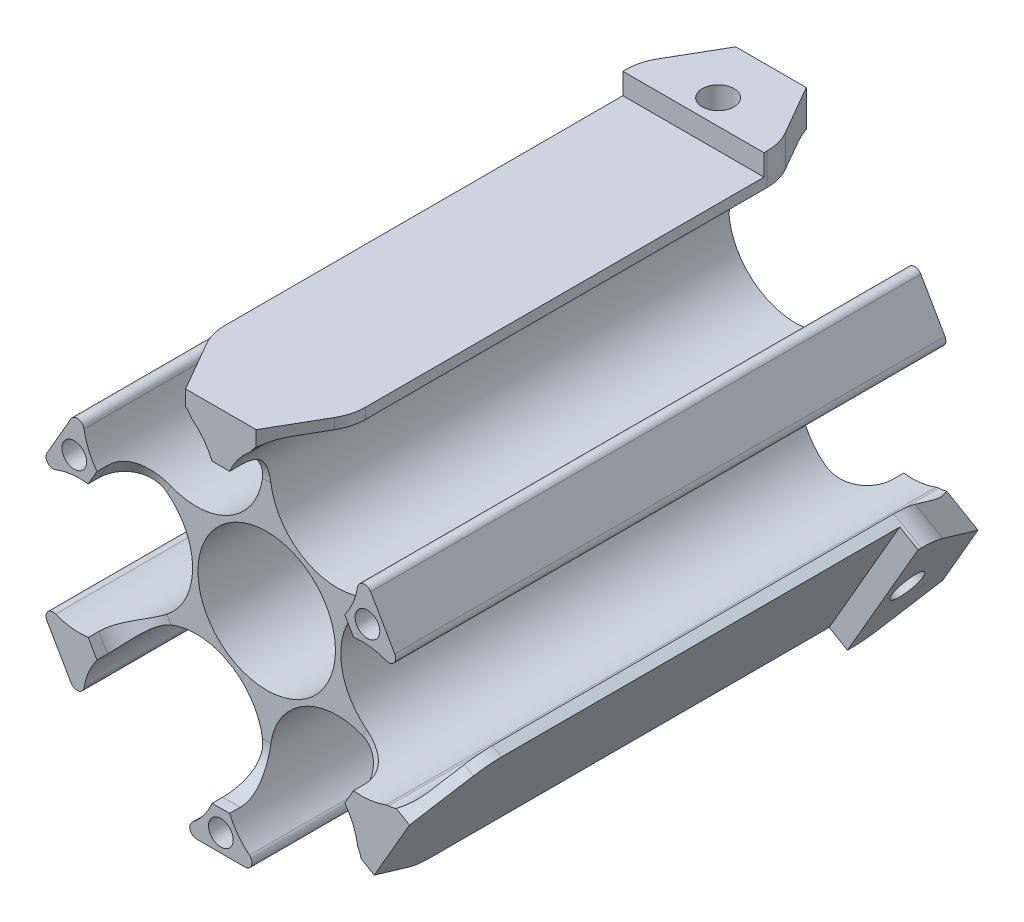
from build123d import *
from OCP.BRepFilletAPI import BRepFilletAPI_MakeChamfer

# Parameters (mm, degrees)
SKETCH_1_R               = 9.75
EXTRUDE_1_DEPTH          = 78
FILLET_1_R               = 1
SKETCH_2_R               = 1.75
CUT_EXTRUDE_1_DEPTH      = 178.5
CUT_EXTRUDE_2_DEPTH      = 6.5
FILLET_2_R               = 5
CUT_EXTRUDE_3_DEPTH      = 6.5
FILLET_3_R               = 5
SKETCH_9_W               = 20
SKETCH_9_H               = 78
EXTRUDE_4_DEPTH          = 1.5
PATTERN_CIRCULAR_6_COUNT = 3
FILLET_4_DEPTH           = 78
SKETCH_11_W              = 11
SKETCH_11_H              = 20
EXTRUDE_5_DEPTH          = 3
PATTERN_CIRCULAR_7_COUNT = 3
CHAMFER_3_SIZE           = 5
CHAMFER_3_SIZE2          = 8.660254038
CHAMFER_4_SIZE           = 5
CHAMFER_4_SIZE2          = 8.660254038
SKETCH_13_R              = 2.25
CUT_EXTRUDE_6_DEPTH      = 6
PATTERN_CIRCULAR_8_COUNT = 3
FILLET_5_R               = 7


with BuildPart() as part:
    # Эскиз1 → Бобышка-Вытянуть1 (new body)
    with BuildSketch(Plane.XY):
        with BuildLine():
            ThreePointArc((-0.5, 17.320508076), (-11.246135967, 7.902591897), (-19.17308319, 19.791245777))
            Line((-19.17308319, 19.791245777), (-26.726263211, 6.708754223))
            ThreePointArc((-26.726263211, 6.708754223), (-16.370227314, 8.779222645), (-10.5, 0))
            ThreePointArc((-10.5, 0), (-16.370227314, -8.779222645), (-26.726263211, -6.708754223))
            Line((-26.726263211, -6.708754223), (-19.17308319, -19.791245777))
            ThreePointArc((-19.17308319, -19.791245777), (-11.246135967, -7.902591897), (-0.5, -17.320508076))
            ThreePointArc((-0.5, -17.320508076), (-2.466913322, -23.108651569), (-7.553180021, -26.5))
            Line((-7.553180021, -26.5), (7.553180021, -26.5))
            ThreePointArc((7.553180021, -26.5), (4.211856507, -9.787421397), (19.5, -17.320508076))
            ThreePointArc((19.5, -17.320508076), (19.417916179, -18.566644042), (19.17308319, -19.791245777))
            Line((19.17308319, -19.791245777), (26.726263211, -6.708754223))
            ThreePointArc((26.726263211, -6.708754223), (10.5, 0), (26.726263211, 6.708754223))
            Line((26.726263211, 6.708754223), (19.17308319, 19.791245777))
            ThreePointArc((19.17308319, 19.791245777), (19.417916179, 18.566644042), (19.5, 17.320508076))
            ThreePointArc((19.5, 17.320508076), (4.211856507, 9.787421397), (7.553180021, 26.5))
            Line((7.553180021, 26.5), (-7.553180021, 26.5))
            ThreePointArc((-7.553180021, 26.5), (-2.466913322, 23.108651569), (-0.5, 17.320508076))
        make_face()
        Circle(SKETCH_1_R, mode=Mode.SUBTRACT)
    extrude(amount=EXTRUDE_1_DEPTH)

    # Скругление1
    fillet_1_edges = [part.edges().sort_by_distance(p)[0] for p in [
        (-26.726263211, 6.708754223, 39),
        (-19.17308319, 19.791245777, 39),
        (-7.553180021, 26.5, 39),
        (7.553180021, 26.5, 39),
        (19.17308319, 19.791245777, 39),
        (26.726263211, 6.708754223, 39),
        (26.726263211, -6.708754223, 39),
        (19.17308319, -19.791245777, 39),
        (7.553180021, -26.5, 39),
        (-7.553180021, -26.5, 39),
        (-19.17308319, -19.791245777, 39),
        (-26.726263211, -6.708754223, 39),
    ]]
    fillet(fillet_1_edges, radius=FILLET_1_R)

    # Эскиз2 → Вырез-Вытянуть1 (cut)
    with BuildSketch(Plane(origin=(0, 0, 0), x_dir=(-1, 0, 0), z_dir=(0, 0, -1))):
        with Locations((0, -24)):
            Circle(SKETCH_2_R)
        with Locations((-20.784609691, 12)):
            Circle(SKETCH_2_R)
        with Locations((20.784609691, 12)):
            Circle(SKETCH_2_R)
    extrude(amount=-CUT_EXTRUDE_1_DEPTH, mode=Mode.SUBTRACT)

    # Эскиз4 → Вырез-Вытянуть2 (cut)
    with BuildSketch(Plane(origin=(0, 0, 0), x_dir=(-1, 0, 0), z_dir=(0, 0, -1))):
        Polygon((-24.248711306, 0), (-12.124355653, -21), (12.124355653, -21), (24.248711306, 0), (12.124355653, 21), (-12.124355653, 21), align=None)
    extrude(amount=-CUT_EXTRUDE_2_DEPTH, mode=Mode.SUBTRACT)

    # Скругление2
    # the kernel refuses this fillet: 5 mm, written as the material it adds along each edge
    with BuildSketch(Plane(origin=(-11.315783963, -22.400487249, 6.5), x_dir=(0.8660254037844387, 0.49999999999999967, 0), z_dir=(-0.4999999999999997, 0.8660254037844388, 0))) as fillet_2_piece_1_section:
        with BuildLine():
            CenterArc((FILLET_2_R, FILLET_2_R), FILLET_2_R, 180, 90)
            Line((0, FILLET_2_R), (0, 0))
            Line((0, 0), (FILLET_2_R, 0))
        make_face()
    fillet_2_piece_1 = extrude(amount=27.482998067, mode=Mode.PRIVATE)
    fillet_2_piece_1 = fillet_2_piece_1 - Plane(origin=(-10, -17.320508076, 6.5), x_dir=(-0.9655877042082922, -0.26007765279192985, 0), z_dir=(0, 0, -1)) * Cylinder(9.5, 75, mode=Mode.PRIVATE)
    fillet_2_piece_1 = fillet_2_piece_1 - Plane(origin=(-20, 0, 6.5), x_dir=(-0.7080277063785602, 0.7061846550303366, 0), z_dir=(0, 0, -1)) * Cylinder(9.5, 75, mode=Mode.PRIVATE)
    add(fillet_2_piece_1)
    with BuildSketch(Plane(origin=(13.741499034, -21, 6.5), x_dir=(0, 0, -1), z_dir=(-1, 0, 0))) as fillet_2_piece_2_section:
        with BuildLine():
            CenterArc((FILLET_2_R, -FILLET_2_R), FILLET_2_R, 90, 90)
            Line((0, -FILLET_2_R), (0, 0))
            Line((0, 0), (FILLET_2_R, 0))
        make_face()
    fillet_2_piece_2 = extrude(amount=27.482998067, mode=Mode.PRIVATE)
    fillet_2_piece_2 = fillet_2_piece_2 - Plane(origin=(-10, -17.320508076, 6.5), x_dir=(-0.9655877042082922, -0.26007765279192985, 0), z_dir=(0, 0, -1)) * Cylinder(9.5, 75, mode=Mode.PRIVATE)
    fillet_2_piece_2 = fillet_2_piece_2 - Plane(origin=(10, -17.320508076, 6.5), x_dir=(-0.25755999782971145, -0.9662623078222389, 0), z_dir=(0, 0, -1)) * Cylinder(9.5, 75, mode=Mode.PRIVATE)
    add(fillet_2_piece_2)
    with BuildSketch(Plane(origin=(25.057282996, 1.400487249, 6.5), x_dir=(-0.8660254037844386, 0.4999999999999999, 0), z_dir=(-0.5, -0.8660254037844387, 0))) as fillet_2_piece_3_section:
        with BuildLine():
            CenterArc((FILLET_2_R, FILLET_2_R), FILLET_2_R, 180, 90)
            Line((0, FILLET_2_R), (0, 0))
            Line((0, 0), (FILLET_2_R, 0))
        make_face()
    fillet_2_piece_3 = extrude(amount=27.482998067, mode=Mode.PRIVATE)
    fillet_2_piece_3 = fillet_2_piece_3 - Plane(origin=(10, -17.320508076, 6.5), x_dir=(-0.25755999782971145, -0.9662623078222389, 0), z_dir=(0, 0, -1)) * Cylinder(9.5, 75, mode=Mode.PRIVATE)
    fillet_2_piece_3 = fillet_2_piece_3 - Plane(origin=(20, 0, 6.5), x_dir=(0.7080277063785567, -0.7061846550303401, 0), z_dir=(0, 0, -1)) * Cylinder(9.5, 75, mode=Mode.PRIVATE)
    add(fillet_2_piece_3)
    with BuildSketch(Plane(origin=(11.315783963, 22.400487249, 6.5), x_dir=(-0.8660254037844389, -0.49999999999999967, 0), z_dir=(0.49999999999999967, -0.8660254037844389, 0))) as fillet_2_piece_4_section:
        with BuildLine():
            CenterArc((FILLET_2_R, FILLET_2_R), FILLET_2_R, 180, 90)
            Line((0, FILLET_2_R), (0, 0))
            Line((0, 0), (FILLET_2_R, 0))
        make_face()
    fillet_2_piece_4 = extrude(amount=27.482998067, mode=Mode.PRIVATE)
    fillet_2_piece_4 = fillet_2_piece_4 - Plane(origin=(20, 0, 6.5), x_dir=(0.7080277063785567, -0.7061846550303401, 0), z_dir=(0, 0, -1)) * Cylinder(9.5, 75, mode=Mode.PRIVATE)
    fillet_2_piece_4 = fillet_2_piece_4 - Plane(origin=(10, 17.320508076, 6.5), x_dir=(0.9655877042082929, 0.2600776527919273, 0), z_dir=(0, 0, -1)) * Cylinder(9.5, 75, mode=Mode.PRIVATE)
    add(fillet_2_piece_4)
    with BuildSketch(Plane(origin=(-13.741499034, 21, 6.5), x_dir=(0, -1, 0), z_dir=(1, 0, 0))) as fillet_2_piece_5_section:
        with BuildLine():
            CenterArc((FILLET_2_R, FILLET_2_R), FILLET_2_R, 180, 90)
            Line((0, FILLET_2_R), (0, 0))
            Line((0, 0), (FILLET_2_R, 0))
        make_face()
    fillet_2_piece_5 = extrude(amount=27.482998067, mode=Mode.PRIVATE)
    fillet_2_piece_5 = fillet_2_piece_5 - Plane(origin=(10, 17.320508076, 6.5), x_dir=(0.9655877042082929, 0.2600776527919273, 0), z_dir=(0, 0, -1)) * Cylinder(9.5, 75, mode=Mode.PRIVATE)
    fillet_2_piece_5 = fillet_2_piece_5 - Plane(origin=(-10, 17.320508076, 6.5), x_dir=(0.25755999782976996, 0.9662623078222233, 0), z_dir=(0, 0, -1)) * Cylinder(9.5, 75, mode=Mode.PRIVATE)
    add(fillet_2_piece_5)
    with BuildSketch(Plane(origin=(-25.057282996, -1.400487249, 6.5), x_dir=(0.8660254037844384, -0.5000000000000003, 0), z_dir=(0.5000000000000004, 0.8660254037844385, 0))) as fillet_2_piece_6_section:
        with BuildLine():
            CenterArc((FILLET_2_R, FILLET_2_R), FILLET_2_R, 180, 90)
            Line((0, FILLET_2_R), (0, 0))
            Line((0, 0), (FILLET_2_R, 0))
        make_face()
    fillet_2_piece_6 = extrude(amount=27.482998067, mode=Mode.PRIVATE)
    fillet_2_piece_6 = fillet_2_piece_6 - Plane(origin=(-20, 0, 6.5), x_dir=(-0.7080277063785602, 0.7061846550303366, 0), z_dir=(0, 0, -1)) * Cylinder(9.5, 75, mode=Mode.PRIVATE)
    fillet_2_piece_6 = fillet_2_piece_6 - Plane(origin=(-10, 17.320508076, 6.5), x_dir=(0.25755999782976996, 0.9662623078222233, 0), z_dir=(0, 0, -1)) * Cylinder(9.5, 75, mode=Mode.PRIVATE)
    add(fillet_2_piece_6)

    # Эскиз5 → Вырез-Вытянуть3 (cut)
    with BuildSketch(Plane.XY.offset(78)):
        Polygon((12.124355653, -21), (24.248711306, 0), (12.124355653, 21), (-12.124355653, 21), (-24.248711306, 0), (-12.124355653, -21), align=None)
    extrude(amount=-CUT_EXTRUDE_3_DEPTH, mode=Mode.SUBTRACT)

    # Скругление3
    # the kernel refuses this fillet: 5 mm, written as the material it adds along each edge
    with BuildSketch(Plane(origin=(25.057282996, -1.400487249, 71.5), x_dir=(-0.8660254037844389, -0.49999999999999967, 0), z_dir=(-0.49999999999999967, 0.8660254037844389, 0))) as fillet_3_piece_1_section:
        with BuildLine():
            CenterArc((FILLET_3_R, FILLET_3_R), FILLET_3_R, 180, 90)
            Line((0, FILLET_3_R), (0, 0))
            Line((0, 0), (FILLET_3_R, 0))
        make_face()
    fillet_3_piece_1 = extrude(amount=27.482998067, mode=Mode.PRIVATE)
    fillet_3_piece_1 = fillet_3_piece_1 - Plane(origin=(10, 17.320508076, 71.5), x_dir=(0.9655877042082548, 0.2600776527920686, 0), z_dir=(0, 0, -1)) * Cylinder(9.5, 75, mode=Mode.PRIVATE)
    fillet_3_piece_1 = fillet_3_piece_1 - Plane(origin=(20, 0, 71.5), x_dir=(0.7080277063789479, -0.706184655029948, 0), z_dir=(0, 0, -1)) * Cylinder(9.5, 75, mode=Mode.PRIVATE)
    add(fillet_3_piece_1)
    with BuildSketch(Plane(origin=(11.315783963, -22.400487249, 71.5), x_dir=(-0.8660254037844387, 0.5, 0), z_dir=(0.5, 0.8660254037844387, 0))) as fillet_3_piece_2_section:
        with BuildLine():
            CenterArc((FILLET_3_R, FILLET_3_R), FILLET_3_R, 180, 90)
            Line((0, FILLET_3_R), (0, 0))
            Line((0, 0), (FILLET_3_R, 0))
        make_face()
    fillet_3_piece_2 = extrude(amount=27.482998067, mode=Mode.PRIVATE)
    fillet_3_piece_2 = fillet_3_piece_2 - Plane(origin=(10, -17.320508076, 71.5), x_dir=(-0.2575599978300403, -0.9662623078221512, 0), z_dir=(0, 0, -1)) * Cylinder(9.5, 75, mode=Mode.PRIVATE)
    fillet_3_piece_2 = fillet_3_piece_2 - Plane(origin=(20, 0, 71.5), x_dir=(0.7080277063789479, -0.706184655029948, 0), z_dir=(0, 0, -1)) * Cylinder(9.5, 75, mode=Mode.PRIVATE)
    add(fillet_3_piece_2)
    with BuildSketch(Plane(origin=(-13.741499034, -21, 71.5), x_dir=(0, 1, 0), z_dir=(1, 0, 0))) as fillet_3_piece_3_section:
        with BuildLine():
            CenterArc((FILLET_3_R, FILLET_3_R), FILLET_3_R, 180, 90)
            Line((0, FILLET_3_R), (0, 0))
            Line((0, 0), (FILLET_3_R, 0))
        make_face()
    fillet_3_piece_3 = extrude(amount=27.482998067, mode=Mode.PRIVATE)
    fillet_3_piece_3 = fillet_3_piece_3 - Plane(origin=(10, -17.320508076, 71.5), x_dir=(-0.2575599978300403, -0.9662623078221512, 0), z_dir=(0, 0, -1)) * Cylinder(9.5, 75, mode=Mode.PRIVATE)
    fillet_3_piece_3 = fillet_3_piece_3 - Plane(origin=(-10, -17.320508076, 71.5), x_dir=(-0.9655877042082548, -0.2600776527920686, 0), z_dir=(0, 0, -1)) * Cylinder(9.5, 75, mode=Mode.PRIVATE)
    add(fillet_3_piece_3)
    with BuildSketch(Plane(origin=(-25.057282996, 1.400487249, 71.5), x_dir=(0, 0, 1), z_dir=(0.4999999999999997, -0.8660254037844388, 0))) as fillet_3_piece_4_section:
        with BuildLine():
            CenterArc((FILLET_3_R, -FILLET_3_R), FILLET_3_R, 90, 90)
            Line((0, -FILLET_3_R), (0, 0))
            Line((0, 0), (FILLET_3_R, 0))
        make_face()
    fillet_3_piece_4 = extrude(amount=27.482998067, mode=Mode.PRIVATE)
    fillet_3_piece_4 = fillet_3_piece_4 - Plane(origin=(-20, 0, 71.5), x_dir=(-0.7080277063789479, 0.706184655029948, 0), z_dir=(0, 0, -1)) * Cylinder(9.5, 75, mode=Mode.PRIVATE)
    fillet_3_piece_4 = fillet_3_piece_4 - Plane(origin=(-10, -17.320508076, 71.5), x_dir=(-0.9655877042082548, -0.2600776527920686, 0), z_dir=(0, 0, -1)) * Cylinder(9.5, 75, mode=Mode.PRIVATE)
    add(fillet_3_piece_4)
    with BuildSketch(Plane(origin=(-11.315783963, 22.400487249, 71.5), x_dir=(0.8660254037844385, -0.5000000000000004, 0), z_dir=(-0.5000000000000004, -0.8660254037844385, 0))) as fillet_3_piece_5_section:
        with BuildLine():
            CenterArc((FILLET_3_R, FILLET_3_R), FILLET_3_R, 180, 90)
            Line((0, FILLET_3_R), (0, 0))
            Line((0, 0), (FILLET_3_R, 0))
        make_face()
    fillet_3_piece_5 = extrude(amount=27.482998067, mode=Mode.PRIVATE)
    fillet_3_piece_5 = fillet_3_piece_5 - Plane(origin=(-20, 0, 71.5), x_dir=(-0.7080277063789479, 0.706184655029948, 0), z_dir=(0, 0, -1)) * Cylinder(9.5, 75, mode=Mode.PRIVATE)
    fillet_3_piece_5 = fillet_3_piece_5 - Plane(origin=(-10, 17.320508076, 71.5), x_dir=(0.2575599978300403, 0.9662623078221512, 0), z_dir=(0, 0, -1)) * Cylinder(9.5, 75, mode=Mode.PRIVATE)
    add(fillet_3_piece_5)
    with BuildSketch(Plane(origin=(13.741499034, 21, 71.5), x_dir=(0, -1, 0), z_dir=(-1, 0, 0))) as fillet_3_piece_6_section:
        with BuildLine():
            CenterArc((FILLET_3_R, FILLET_3_R), FILLET_3_R, 180, 90)
            Line((0, FILLET_3_R), (0, 0))
            Line((0, 0), (FILLET_3_R, 0))
        make_face()
    fillet_3_piece_6 = extrude(amount=27.482998067, mode=Mode.PRIVATE)
    fillet_3_piece_6 = fillet_3_piece_6 - Plane(origin=(-10, 17.320508076, 71.5), x_dir=(0.2575599978300403, 0.9662623078221512, 0), z_dir=(0, 0, -1)) * Cylinder(9.5, 75, mode=Mode.PRIVATE)
    fillet_3_piece_6 = fillet_3_piece_6 - Plane(origin=(10, 17.320508076, 71.5), x_dir=(0.9655877042082548, 0.2600776527920686, 0), z_dir=(0, 0, -1)) * Cylinder(9.5, 75, mode=Mode.PRIVATE)
    add(fillet_3_piece_6)

    # Эскиз9 → Бобышка-Вытянуть4 (add)
    with BuildSketch(Plane(origin=(0, 26.5, 0), x_dir=(1, 0, 0), z_dir=(0, 1, 0))):
        with Locations((0, -39)):
            Rectangle(SKETCH_9_W, SKETCH_9_H)
    extrude_4 = extrude(amount=EXTRUDE_4_DEPTH)

    # Круговой массив6: Бобышка-Вытянуть4 ×3 about axis, 1 skipped
    pattern_circular_6_axis = Axis((0, 0, 78), (0, 0, 1))
    add([extrude_4.rotate(pattern_circular_6_axis, i * 360 / PATTERN_CIRCULAR_6_COUNT) for i in range(1, PATTERN_CIRCULAR_6_COUNT) if i not in (1,)])

    # Скругление4: read off the stored shape, not the designer's step
    # Скругление4 outline → Скругление4 (add)
    with BuildSketch(Plane.XY):
        with BuildLine():
            ThreePointArc((21.241553812, -16.208549565), (20.375528409, -16.708549564), (19.509503005, -16.208549565))
            ThreePointArc((19.509503005, -16.208549565), (19.911426794, -17.708549565), (19.509503005, -19.208549565))
            Line((19.509503005, -19.208549565), (21.241553812, -16.208549565))
        make_face()
        with BuildLine():
            Line((24.657792588, -10.291450435), (26.389843396, -7.291450435))
            ThreePointArc((26.389843396, -7.291450435), (25.291767184, -8.389526646), (23.791767184, -8.791450435))
            ThreePointArc((23.791767184, -8.791450435), (24.657792588, -9.291450435), (24.657792588, -10.291450435))
        make_face()
        with BuildLine():
            Line((-3.416238776, 26.5), (-6.880340391, 26.5))
            ThreePointArc((-6.880340391, 26.5), (-5.380340391, 26.098076211), (-4.282264179, 25))
            ThreePointArc((-4.282264179, 25), (-4.282264179, 26), (-3.416238776, 26.5))
        make_face()
        with BuildLine():
            ThreePointArc((3.416238776, 26.5), (4.282264179, 26), (4.282264179, 25))
            ThreePointArc((4.282264179, 25), (5.380340391, 26.098076211), (6.880340391, 26.5))
            Line((6.880340391, 26.5), (3.416238776, 26.5))
        make_face()
    extrude(amount=FILLET_4_DEPTH)

    # Эскиз11 → Бобышка-Вытянуть5 (add)
    with BuildSketch(Plane(origin=(24.248711306, -14, 0), x_dir=(0, 0, -1), z_dir=(0.8660254037844433, -0.4999999999999923, 0))):
        with Locations((-5.5, 0)):
            Rectangle(SKETCH_11_W, SKETCH_11_H)
    extrude_5 = extrude(amount=EXTRUDE_5_DEPTH)

    # Круговой массив7: Бобышка-Вытянуть5 ×3 about axis, 1 skipped
    pattern_circular_7_axis = Axis((0, 0, 78), (0, 0, 1))
    add([extrude_5.rotate(pattern_circular_7_axis, i * 360 / PATTERN_CIRCULAR_7_COUNT) for i in range(1, PATTERN_CIRCULAR_7_COUNT) if i not in (2,)])

    # Фаска3: one chamfer whose edges measure the first distance from different faces: ONE call of the kernel's chamfer builder (chamfer() names one face for all edges)
    chamfer_3_edges_1 = [part.edges().sort_by_distance(p)[0] for p in [
        (-10, 28.75, 0),
    ]]
    chamfer_3_side_1 = [part.faces().sort_by_distance(p)[0] for p in [
        (0, 27.53297258, 0),
    ]]
    chamfer_3_edges_2 = [part.edges().sort_by_distance(p)[0] for p in [
        (10, 27.25, 78),
    ]]
    chamfer_3_side_2 = [part.faces().sort_by_distance(p)[0] for p in [
        (0, 25.725684777, 78),
    ]]
    chamfer_3_edges_3 = [part.edges().sort_by_distance(p)[0] for p in [
        (29.898230359, -5.714745962, 0),
    ]]
    chamfer_3_side_3 = [part.faces().sort_by_distance(p)[0] for p in [
        (23.844253696, -13.76648629, 0),
    ]]
    chamfer_3_edges_4 = [part.edges().sort_by_distance(p)[0] for p in [
        (18.599192253, -22.285254038, 78),
    ]]
    chamfer_3_side_4 = [part.faces().sort_by_distance(p)[0] for p in [
        (22.279096546, -12.862842388, 78),
    ]]
    chamfer_3 = BRepFilletAPI_MakeChamfer(part.part.solid().wrapped)
    for e in chamfer_3_edges_1:
        chamfer_3.Add(CHAMFER_3_SIZE, CHAMFER_3_SIZE2, e.wrapped, chamfer_3_side_1[0].wrapped)  # the first distance lies on this face
    for e in chamfer_3_edges_2:
        chamfer_3.Add(CHAMFER_3_SIZE, CHAMFER_3_SIZE2, e.wrapped, chamfer_3_side_2[0].wrapped)  # the first distance lies on this face
    for e in chamfer_3_edges_3:
        chamfer_3.Add(CHAMFER_3_SIZE, CHAMFER_3_SIZE2, e.wrapped, chamfer_3_side_3[0].wrapped)  # the first distance lies on this face
    for e in chamfer_3_edges_4:
        chamfer_3.Add(CHAMFER_3_SIZE, CHAMFER_3_SIZE2, e.wrapped, chamfer_3_side_4[0].wrapped)  # the first distance lies on this face
    add(Compound.cast(chamfer_3.Shape()), mode=Mode.REPLACE)

    # Фаска4: one chamfer whose edges measure the first distance from different faces: ONE call of the kernel's chamfer builder (chamfer() names one face for all edges)
    chamfer_4_edges_1 = [part.edges().sort_by_distance(p)[0] for p in [
        (10, 28.75, 0),
    ]]
    chamfer_4_side_1 = [part.faces().sort_by_distance(p)[0] for p in [
        (1.668868734, 27.270313738, 0),
    ]]
    chamfer_4_edges_2 = [part.edges().sort_by_distance(p)[0] for p in [
        (-10, 27.25, 78),
    ]]
    chamfer_4_side_2 = [part.faces().sort_by_distance(p)[0] for p in [
        (-1.017378688, 25.522553225, 78),
    ]]
    chamfer_4_edges_3 = [part.edges().sort_by_distance(p)[0] for p in [
        (19.898230359, -23.035254038, 0),
    ]]
    chamfer_4_side_3 = [part.faces().sort_by_distance(p)[0] for p in [
        (22.782350099, -15.080439588, 0),
    ]]
    chamfer_4_edges_4 = [part.edges().sort_by_distance(p)[0] for p in [
        (28.599192253, -4.964745962, 78),
    ]]
    chamfer_4_side_4 = [part.faces().sort_by_distance(p)[0] for p in [
        (22.611868807, -11.880200824, 78),
    ]]
    chamfer_4 = BRepFilletAPI_MakeChamfer(part.part.solid().wrapped)
    for e in chamfer_4_edges_1:
        chamfer_4.Add(CHAMFER_4_SIZE, CHAMFER_4_SIZE2, e.wrapped, chamfer_4_side_1[0].wrapped)  # the first distance lies on this face
    for e in chamfer_4_edges_2:
        chamfer_4.Add(CHAMFER_4_SIZE, CHAMFER_4_SIZE2, e.wrapped, chamfer_4_side_2[0].wrapped)  # the first distance lies on this face
    for e in chamfer_4_edges_3:
        chamfer_4.Add(CHAMFER_4_SIZE, CHAMFER_4_SIZE2, e.wrapped, chamfer_4_side_3[0].wrapped)  # the first distance lies on this face
    for e in chamfer_4_edges_4:
        chamfer_4.Add(CHAMFER_4_SIZE, CHAMFER_4_SIZE2, e.wrapped, chamfer_4_side_4[0].wrapped)  # the first distance lies on this face
    add(Compound.cast(chamfer_4.Shape()), mode=Mode.REPLACE)

    # Эскиз13 → Вырез-Вытянуть6 (cut)
    with BuildSketch(Plane(origin=(26.846787517, -15.5, 0), x_dir=(0, 0, -1), z_dir=(0.8660254037844431, -0.4999999999999924, 0))):
        with Locations(Location((-7.5, 0, 0), (0, 0, 90))):
            Circle(SKETCH_13_R)
    cut_extrude_6 = extrude(amount=-CUT_EXTRUDE_6_DEPTH, mode=Mode.SUBTRACT)

    # Круговой массив8: Вырез-Вытянуть6 ×3 about axis, 1 skipped
    pattern_circular_8_axis = Axis((0, 0, 78), (0, 0, 1))
    add([cut_extrude_6.rotate(pattern_circular_8_axis, i * 360 / PATTERN_CIRCULAR_8_COUNT) for i in range(1, PATTERN_CIRCULAR_8_COUNT) if i not in (2,)], mode=Mode.SUBTRACT)

    # Скругление5
    fillet_5_edges = [part.edges().sort_by_distance(p)[0] for p in [
        (18.599192253, -22.285254038, 69.339745962),
        (10, 27.25, 69.339745962),
        (-10, 28.75, 8.660254038),
        (29.898230359, -5.714745962, 8.660254038),
        (-10, 27.25, 69.339745962),
        (10, 28.75, 8.660254038),
        (19.898230359, -23.035254038, 8.660254038),
        (28.599192253, -4.964745962, 69.339745962),
    ]]
    fillet(fillet_5_edges, radius=FILLET_5_R)


solid = part.part
